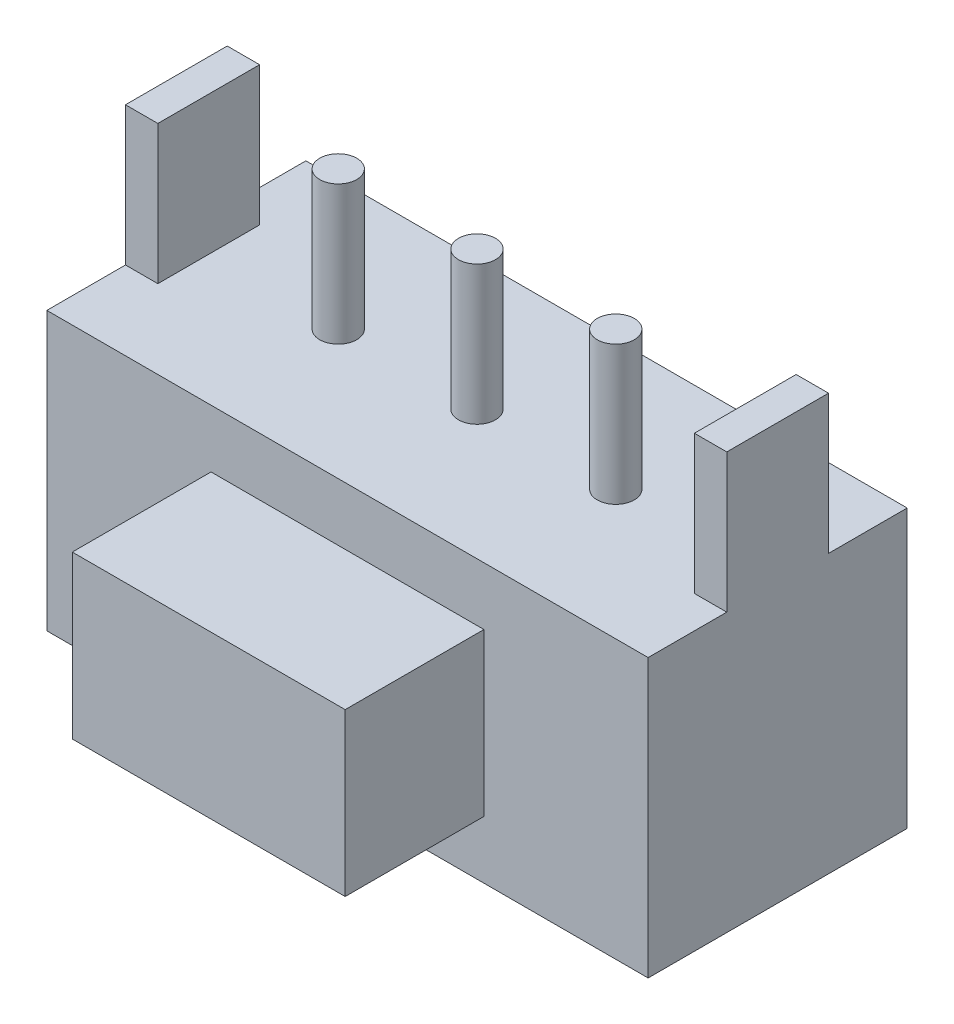
from build123d import *

# Parameters (mm, degrees)
SKETCH1_W           = 13
SKETCH1_H           = 5.6
BOSS_EXTRUDE1_DEPTH = 6
SKETCH2_R           = 0.4
SKETCH2_W           = 0.7
SKETCH2_H           = 2.2
BOSS_EXTRUDE2_DEPTH = 3
SKETCH3_W           = 5.9
SKETCH3_H           = 3.5
BOSS_EXTRUDE3_DEPTH = 3


with BuildPart() as part:
    # Sketch1 → Boss-Extrude1 (new body)
    with BuildSketch(Plane(origin=(0, 0, 0), x_dir=(1, 0, 0), z_dir=(0, 1, 0))):
        Rectangle(SKETCH1_W, SKETCH1_H)
    extrude(amount=BOSS_EXTRUDE1_DEPTH)

    # Sketch2 → Boss-Extrude2 (add)
    with BuildSketch(Plane(origin=(0, 6, 0), x_dir=(1, 0, 0), z_dir=(0, 1, 0))):
        with Locations((-3, 0)):
            Circle(SKETCH2_R)
        Circle(SKETCH2_R)
        with Locations((3, 0)):
            Circle(SKETCH2_R)
        with Locations((-6.15, 0)):
            Rectangle(SKETCH2_W, SKETCH2_H)
        with Locations((6.15, 0)):
            Rectangle(SKETCH2_W, SKETCH2_H)
    extrude(amount=BOSS_EXTRUDE2_DEPTH)

    # Sketch3 → Boss-Extrude3 (add)
    with BuildSketch(Plane.XY.offset(2.8)):
        with Locations((0, 3)):
            Rectangle(SKETCH3_W, SKETCH3_H)
    extrude(amount=BOSS_EXTRUDE3_DEPTH)


solid = part.part
